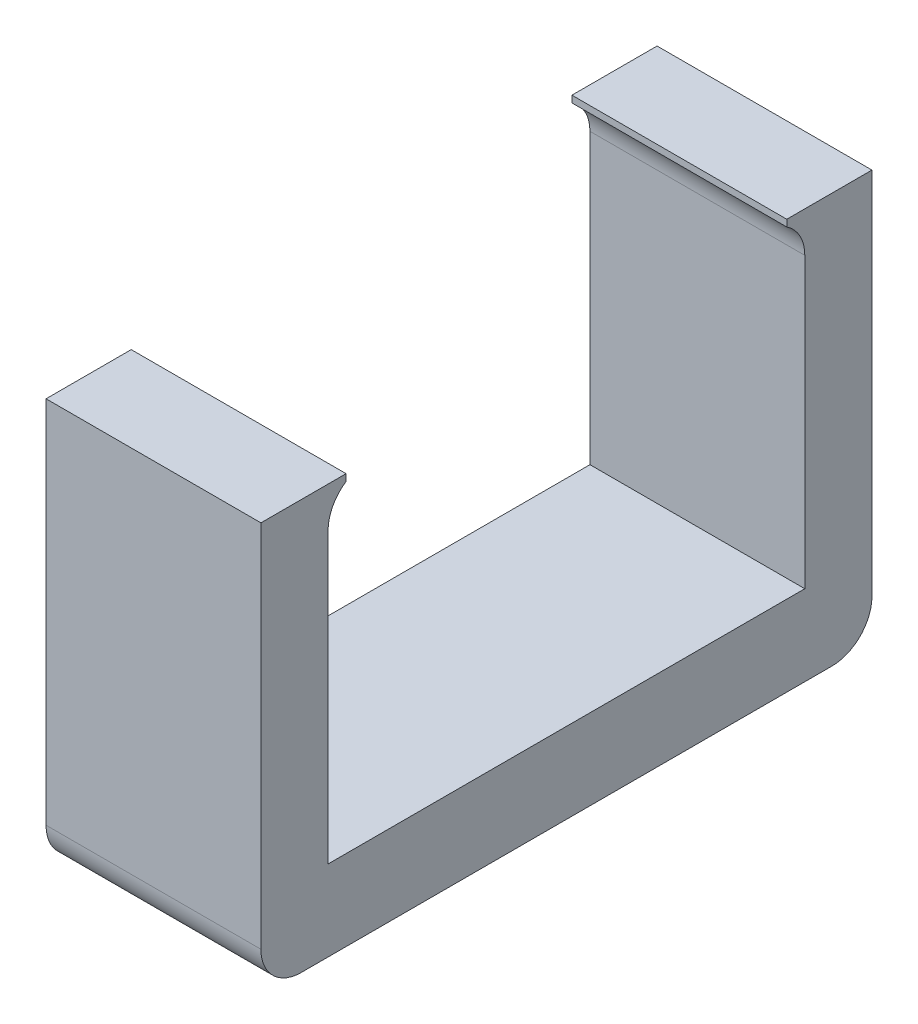
from build123d import *

# Parameters (mm, degrees)
PROFILEBOSS_EXTRUDE1_DEPTH = 8


with BuildPart() as part:
    # Sketch2 → ProfileBoss-Extrude1 (new body)
    with BuildSketch(Plane(origin=(0, 0, 0), x_dir=(0, 0, -1), z_dir=(1, 0, 0))):
        with BuildLine():
            Line((1.5, 0), (21.25, 0))
            ThreePointArc((21.25, 0), (22.310660172, 0.439339828), (22.75, 1.5))
            Line((22.75, 1.5), (22.75, 15.25))
            Line((22.75, 15.25), (19.579156198, 15.25))
            Line((19.579156198, 15.25), (19.579156198, 15))
            ThreePointArc((19.579156198, 15), (20.071691018, 14.459318583), (20.25, 13.75))
            Line((20.25, 13.75), (20.25, 3))
            Line((20.25, 3), (2.5, 3))
            Line((2.5, 3), (2.5, 13.75))
            ThreePointArc((2.5, 13.75), (2.678308982, 14.459318583), (3.170843802, 15))
            Line((3.170843802, 15), (3.170843802, 15.25))
            Line((3.170843802, 15.25), (0, 15.25))
            Line((0, 15.25), (0, 1.5))
            ThreePointArc((0, 1.5), (0.439339828, 0.439339828), (1.5, 0))
        make_face()
    extrude(amount=PROFILEBOSS_EXTRUDE1_DEPTH)


solid = part.part
